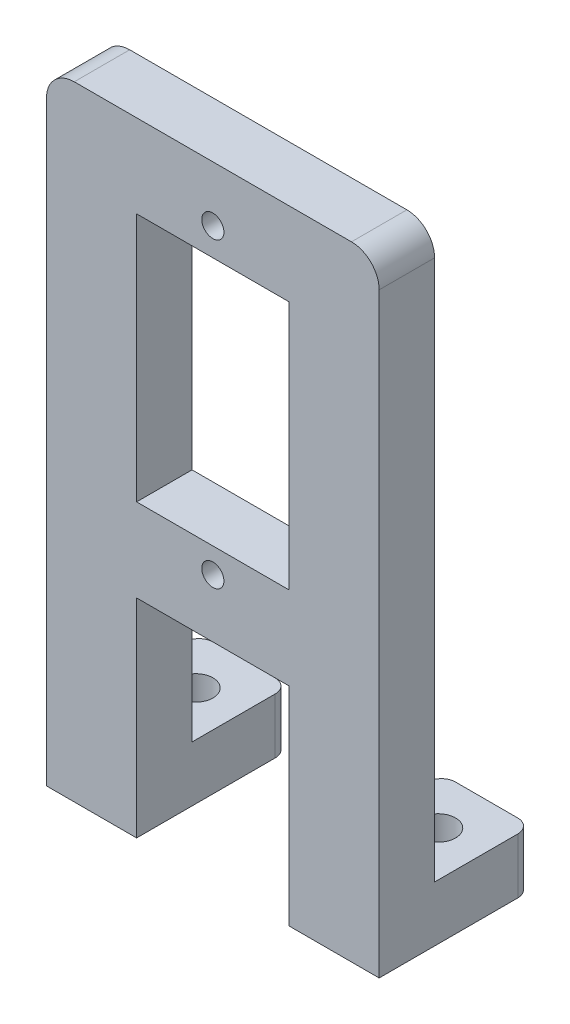
from build123d import *

# Parameters (mm, degrees)
SKETCH1_W           = 8.255
SKETCH1_H           = 19.05
SKETCH1_W_2         = 13.97
SKETCH1_H_2         = 22.86
BOSS_EXTRUDE1_DEPTH = 5.08
FILLET1_R           = 2.54
SKETCH3_W           = 8.255
SKETCH3_H           = 8.89
BOSS_EXTRUDE2_DEPTH = 5.08
SKETCH5_R           = 1.016
CUT_EXTRUDE1_DEPTH  = 5.08
SKETCH6_R           = 1.6
CUT_EXTRUDE2_DEPTH  = 5.08
FILLET2_R           = 1.27


with BuildPart() as part:
    # Sketch1 → Boss-Extrude1 (new body)
    # profile 1 of 3: a face of its own
    with BuildSketch(Plane.XY):
        with Locations((-11.1125, -28.575)):
            Rectangle(SKETCH1_W, SKETCH1_H)
    # profile 2 of 3: a face of its own
    with BuildSketch(Plane.XY):
        Polygon((-15.24, 19.05), (-15.24, -19.05), (-6.985, -19.05), (6.985, -19.05), (15.24, -19.05), (15.24, 19.05), align=None)
        Rectangle(SKETCH1_W_2, SKETCH1_H_2, mode=Mode.SUBTRACT)
    # profile 3 of 3: a face of its own
    with BuildSketch(Plane.XY):
        with Locations((11.1125, -28.575)):
            Rectangle(SKETCH1_W, SKETCH1_H)
    extrude(amount=BOSS_EXTRUDE1_DEPTH)

    # Fillet1
    fillet1_edges = [part.edges().sort_by_distance(p)[0] for p in [
        (15.24, 19.05, 2.54),
        (-15.24, 19.05, 2.54),
    ]]
    fillet(fillet1_edges, radius=FILLET1_R)

    # Sketch3 → Boss-Extrude2 (add)
    with BuildSketch(Plane(origin=(0, -38.1, 0), x_dir=(1, 0, 0), z_dir=(0, 1, 0))):
        with Locations((-11.1125, 4.445)):
            Rectangle(SKETCH3_W, SKETCH3_H)
    boss_extrude2 = extrude(amount=BOSS_EXTRUDE2_DEPTH)

    # Sketch5 → Cut-Extrude1 (cut)
    with BuildSketch(Plane.XY.offset(5.08)):
        with Locations((0, 13.97)):
            Circle(SKETCH5_R)
        with Locations((0, -13.716)):
            Circle(SKETCH5_R)
    extrude(amount=-CUT_EXTRUDE1_DEPTH, mode=Mode.SUBTRACT)

    # Sketch6 → Cut-Extrude2 (cut)
    with BuildSketch(Plane(origin=(0, -33.02, 0), x_dir=(1, 0, 0), z_dir=(0, 1, 0))):
        with Locations((-11.1125, 4.445)):
            Circle(SKETCH6_R)
    cut_extrude2 = extrude(amount=-CUT_EXTRUDE2_DEPTH, mode=Mode.SUBTRACT)

    # Mirror2: Boss-Extrude2, Cut-Extrude2 across plane
    add(boss_extrude2.mirror(Plane(origin=(0, 0, 0), x_dir=(0, 0, 1), z_dir=(1, 0, 0))))
    add(cut_extrude2.mirror(Plane(origin=(0, 0, 0), x_dir=(0, 0, 1), z_dir=(1, 0, 0))), mode=Mode.SUBTRACT)

    # Fillet2
    fillet2_edges = [part.edges().sort_by_distance(p)[0] for p in [
        (-6.985, -35.56, -8.89),
        (15.24, -35.56, -8.89),
        (6.985, -35.56, -8.89),
        (-15.24, -35.56, -8.89),
    ]]
    fillet(fillet2_edges, radius=FILLET2_R)


solid = part.part
